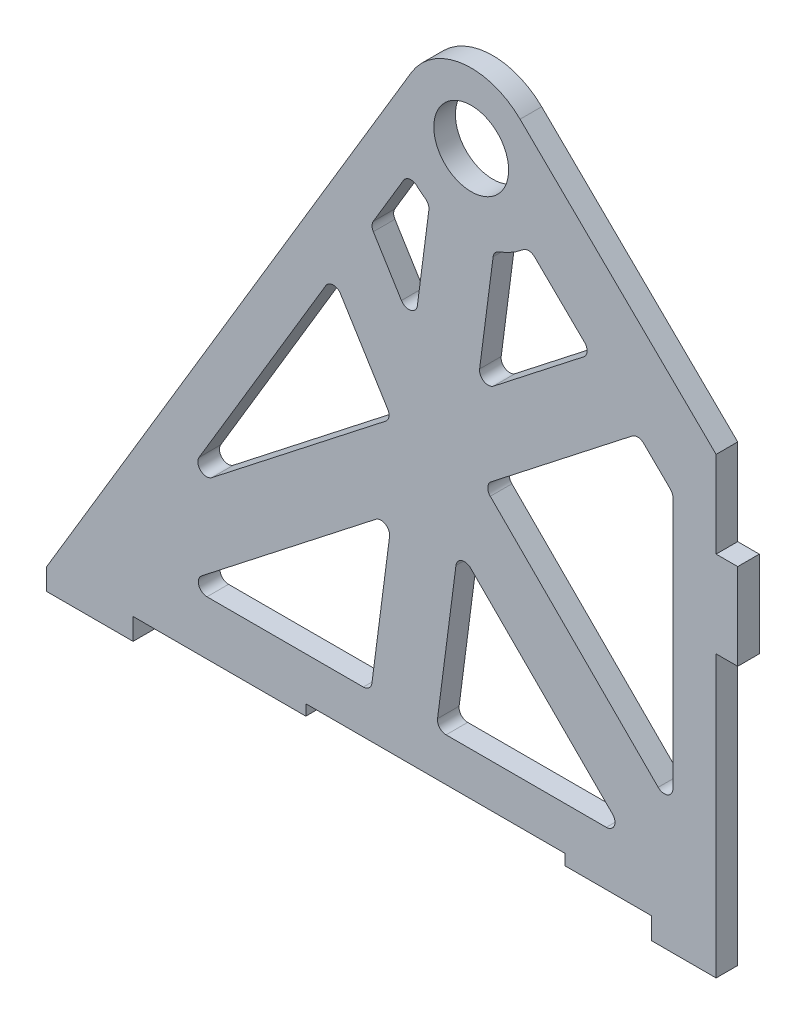
from build123d import *

# Parameters (mm, degrees)
SKETCH2_R           = 11
BOSS_EXTRUDE1_DEPTH = 6.35
CUT_EXTRUDE1_DEPTH  = 280.596929737
FILLET1_R           = 2.54


with BuildPart() as part:
    # Sketch2 → Boss-Extrude1 (new body)
    with BuildSketch(Plane.XY):
        with BuildLine():
            Line((25.4, 2.542062626), (76.2, 2.542062626))
            Line((76.2, 2.542062626), (76.2, 5.717062626))
            Line((76.2, 5.717062626), (152.4, 5.717062626))
            Line((152.4, 5.717062626), (152.4, 2.542062626))
            Line((152.4, 2.542062626), (177.8, 2.542062626))
            Line((177.8, 2.542062626), (177.8, -3.807937374))
            Line((177.8, -3.807937374), (196.85, -3.807937374))
            Line((196.85, -3.807937374), (196.85, 78.742062626))
            Line((196.85, 78.742062626), (203.2, 78.742062626))
            Line((203.2, 78.742062626), (203.2, 104.142062626))
            Line((203.2, 104.142062626), (196.85, 104.142062626))
            Line((196.85, 104.142062626), (196.85, 129.542062626))
            Line((196.85, 129.542062626), (139.204596213, 186.076487834))
            ThreePointArc((139.204596213, 186.076487834), (122.208232851, 191.779061014), (107.214428724, 181.951469947))
            Line((107.214428724, 181.951469947), (0, 2.542062626))
            Line((0, 2.542062626), (0, -3.807937374))
            Line((0, -3.807937374), (25.4, -3.807937374))
            Line((25.4, -3.807937374), (25.4, 2.542062626))
        make_face()
        with Locations((124.833126, 171.422598626)):
            Circle(SKETCH2_R, mode=Mode.SUBTRACT)
    extrude(amount=BOSS_EXTRUDE1_DEPTH)

    # Sketch4 → Cut-Extrude1 (cut, through all)
    with BuildSketch(Plane.XY.offset(6.35)):
        with BuildLine():
            ThreePointArc((112.590867501, 151.129321246), (109.403089737, 153.433602519), (106.640329252, 156.23338711))
            Line((106.640329252, 156.23338711), (95.241664491, 137.159203595))
            Line((95.241664491, 137.159203595), (108.075962418, 116.386657845))
            Line((108.075962418, 116.386657845), (112.590867501, 151.129321246))
        make_face()
        with BuildLine():
            ThreePointArc((141.753816584, 154.828014263), (137.012953418, 151.091789393), (131.482021071, 148.674363654))
            Line((131.482021071, 148.674363654), (126.50513789, 110.376730818))
            Line((126.50513789, 110.376730818), (160.218857543, 136.71884322))
            Line((160.218857543, 136.71884322), (141.753816584, 154.828014263))
        make_face()
        Polygon((101.478261059, 90.822056657), (84.231843224, 118.735699112), (37.832728657, 41.092813319), align=None)
        Polygon((173.938776136, 123.263343551), (128.409628791, 87.689282626), (184.15, 31.894074467), (184.15, 113.248916833), align=None)
        Polygon((101.62722196, 66.762930434), (39.752190498, 18.417062626), (95.344542887, 18.417062626), align=None)
        Polygon((170.686233709, 18.417062626), (121.01587543, 68.136286224), (114.554724978, 18.417062626), align=None)
    extrude(amount=-CUT_EXTRUDE1_DEPTH, mode=Mode.SUBTRACT)

    # Fillet1
    fillet1_edges = [part.edges().sort_by_distance(p)[0] for p in [
        (101.62722196, 66.762930434, 3.175),
        (95.344542887, 18.417062626, 3.175),
        (39.752190498, 18.417062626, 3.175),
        (128.409628791, 87.689282626, 3.175),
        (112.590867501, 151.129321246, 3.175),
        (108.075962418, 116.386657845, 3.175),
        (106.640329252, 156.23338711, 3.175),
        (84.231843224, 118.735699112, 3.175),
        (101.478261059, 90.822056657, 3.175),
        (37.832728657, 41.092813319, 3.175),
        (131.482021071, 148.674363654, 3.175),
        (170.686233709, 18.417062626, 3.175),
        (114.554724978, 18.417062626, 3.175),
        (121.01587543, 68.136286224, 3.175),
        (95.241664491, 137.159203595, 3.175),
        (141.753816584, 154.828014263, 3.175),
        (160.218857543, 136.71884322, 3.175),
        (126.50513789, 110.376730818, 3.175),
        (184.15, 31.894074467, 3.175),
        (173.938776136, 123.263343551, 3.175),
        (184.15, 113.248916833, 3.175),
    ]]
    fillet(fillet1_edges, radius=FILLET1_R)


solid = part.part
